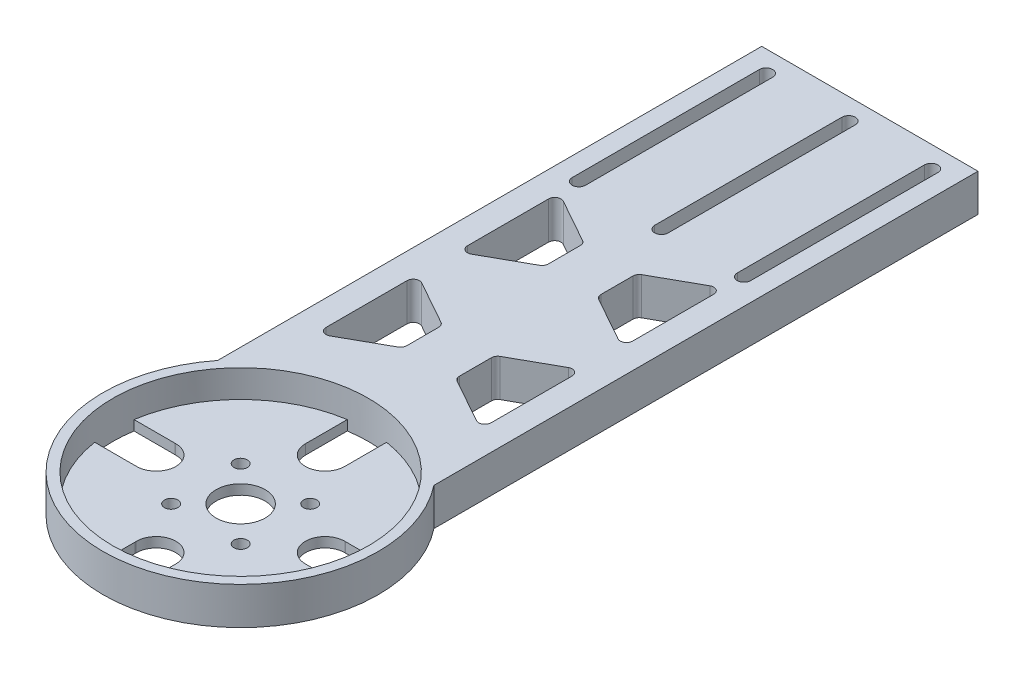
from build123d import *

# Parameters (mm, degrees)
BOSS_EXTRUDE1_OUTLINE_R = 6.25
BOSS_EXTRUDE1_DEPTH     = 9.525
CUT_EXTRUDE1_START      = -7
SKETCH3_R               = 32.5
CUT_EXTRUDE1_DEPTH      = 7
M3_CLEARANCE_HOLE1_D    = 3.4


# Read off the part's stored shape, not the designer's step: Boss-Extrude1
with BuildPart() as part:
    # Boss-Extrude1 outline → Boss-Extrude1 (new body)
    with BuildSketch(Plane(origin=(0, 0, 0), x_dir=(1, 0, 0), z_dir=(0, 1, 0))):
        with BuildLine():
            Line((-27.5, 160), (-27.5, 21.650635095))
            ThreePointArc((-27.5, 21.650635095), (0, -35), (27.5, 21.650635095))
            Line((27.5, 21.650635095), (27.5, 160))
            Line((27.5, 160), (-27.5, 160))
        make_face()
        with BuildLine():
            Line((-21.67, -5), (-32.113081447, -5))
            ThreePointArc((-32.113081447, -5), (-32.5, 0), (-32.113081447, 5))
            Line((-32.113081447, 5), (-21.67, 5))
            ThreePointArc((-21.67, 5), (-21.6199975, 4.999749969), (-21.57, 4.9989999))
            ThreePointArc((-21.57, 4.9989999), (-16.47, 0), (-21.57, -4.9989999))
            ThreePointArc((-21.57, -4.9989999), (-21.6199975, -4.999749969), (-21.67, -5))
        make_face(mode=Mode.SUBTRACT)
        with BuildLine():
            Line((-21, 42.707149814), (-21, 63.292850186))
            ThreePointArc((-21, 63.292850186), (-20.2155368, 64.662261792), (-18.637432255, 64.678283779))
            Line((-18.637432255, 64.678283779), (-7.512432255, 58.454507556))
            ThreePointArc((-7.512432255, 58.454507556), (-6.918088394, 57.872110763), (-6.7, 57.069073962))
            Line((-6.7, 57.069073962), (-6.7, 48.930926038))
            ThreePointArc((-6.7, 48.930926038), (-6.918088394, 48.127889237), (-7.512432255, 47.545492444))
            Line((-7.512432255, 47.545492444), (-18.637432255, 41.321716221))
            ThreePointArc((-18.637432255, 41.321716221), (-20.2155368, 41.337738208), (-21, 42.707149814))
        make_face(mode=Mode.SUBTRACT)
        with BuildLine():
            Line((5, -21.872218084), (5, -32.113081447))
            ThreePointArc((5, -32.113081447), (0, -32.5), (-5, -32.113081447))
            Line((-5, -32.113081447), (-5, -21.872218084))
            ThreePointArc((-5, -21.872218084), (-4.998988367, -21.771643214), (-4.995953878, -21.671109042))
            ThreePointArc((-4.995953878, -21.671109042), (0, -16.47), (4.995953878, -21.671109042))
            ThreePointArc((4.995953878, -21.671109042), (4.998988367, -21.771643214), (5, -21.872218084))
        make_face(mode=Mode.SUBTRACT)
        Circle(BOSS_EXTRUDE1_OUTLINE_R, mode=Mode.SUBTRACT)
        with BuildLine():
            Line((21.67, 5), (32.113081447, 5))
            ThreePointArc((32.113081447, 5), (32.5, 0), (32.113081447, -5))
            Line((32.113081447, -5), (21.67, -5))
            ThreePointArc((21.67, -5), (21.6199975, -4.999749969), (21.57, -4.9989999))
            ThreePointArc((21.57, -4.9989999), (16.47, 0), (21.57, 4.9989999))
            ThreePointArc((21.57, 4.9989999), (21.6199975, 4.999749969), (21.67, 5))
        make_face(mode=Mode.SUBTRACT)
        with BuildLine():
            Line((-5, 21.466517846), (-5, 32.113081447))
            ThreePointArc((-5, 32.113081447), (0, 32.5), (5, 32.113081447))
            Line((5, 32.113081447), (5, 21.466517846))
            ThreePointArc((5, 21.466517846), (0, 16.466517846), (-5, 21.466517846))
        make_face(mode=Mode.SUBTRACT)
        with BuildLine():
            ThreePointArc((7.512432255, 47.545492444), (6.918088394, 48.127889237), (6.7, 48.930926038))
            Line((6.7, 48.930926038), (6.7, 57.069073962))
            ThreePointArc((6.7, 57.069073962), (6.918088394, 57.872110763), (7.512432255, 58.454507556))
            Line((7.512432255, 58.454507556), (18.637432255, 64.678283779))
            ThreePointArc((18.637432255, 64.678283779), (20.2155368, 64.662261792), (21, 63.292850186))
            Line((21, 63.292850186), (21, 42.707149814))
            ThreePointArc((21, 42.707149814), (20.2155368, 41.337738208), (18.637432255, 41.321716221))
            Line((18.637432255, 41.321716221), (7.512432255, 47.545492444))
        make_face(mode=Mode.SUBTRACT)
        with BuildLine():
            Line((-21, 78.707149814), (-21, 99.292850186))
            ThreePointArc((-21, 99.292850186), (-20.2155368, 100.662261792), (-18.637432255, 100.678283779))
            Line((-18.637432255, 100.678283779), (-7.512432255, 94.454507556))
            ThreePointArc((-7.512432255, 94.454507556), (-6.918088394, 93.872110763), (-6.7, 93.069073962))
            Line((-6.7, 93.069073962), (-6.7, 84.930926038))
            ThreePointArc((-6.7, 84.930926038), (-6.918088394, 84.127889237), (-7.512432255, 83.545492444))
            Line((-7.512432255, 83.545492444), (-18.637432255, 77.321716221))
            ThreePointArc((-18.637432255, 77.321716221), (-20.2155368, 77.337738208), (-21, 78.707149814))
        make_face(mode=Mode.SUBTRACT)
        with BuildLine():
            Line((-19.3, 154.596553922), (-19.3, 107))
            ThreePointArc((-19.3, 107), (-21, 105.3), (-22.7, 107))
            Line((-22.7, 107), (-22.7, 154.596553922))
            ThreePointArc((-22.7, 154.596553922), (-21, 156.296553922), (-19.3, 154.596553922))
        make_face(mode=Mode.SUBTRACT)
        with BuildLine():
            ThreePointArc((18.637432255, 100.678283779), (20.2155368, 100.662261792), (21, 99.292850186))
            Line((21, 99.292850186), (21, 78.707149814))
            ThreePointArc((21, 78.707149814), (20.2155368, 77.337738208), (18.637432255, 77.321716221))
            Line((18.637432255, 77.321716221), (7.512432255, 83.545492444))
            ThreePointArc((7.512432255, 83.545492444), (6.918088394, 84.127889237), (6.7, 84.930926038))
            Line((6.7, 84.930926038), (6.7, 93.069073962))
            ThreePointArc((6.7, 93.069073962), (6.918088394, 93.872110763), (7.512432255, 94.454507556))
            Line((7.512432255, 94.454507556), (18.637432255, 100.678283779))
        make_face(mode=Mode.SUBTRACT)
        with BuildLine():
            Line((1.7, 154.596553922), (1.7, 107))
            ThreePointArc((1.7, 107), (0, 105.3), (-1.7, 107))
            Line((-1.7, 107), (-1.7, 154.596553922))
            ThreePointArc((-1.7, 154.596553922), (0, 156.296553922), (1.7, 154.596553922))
        make_face(mode=Mode.SUBTRACT)
        with BuildLine():
            Line((22.7, 154.596553922), (22.7, 107))
            ThreePointArc((22.7, 107), (21, 105.3), (19.3, 107))
            Line((19.3, 107), (19.3, 154.596553922))
            ThreePointArc((19.3, 154.596553922), (21, 156.296553922), (22.7, 154.596553922))
        make_face(mode=Mode.SUBTRACT)
    extrude(amount=BOSS_EXTRUDE1_DEPTH)

    # Sketch3 → Cut-Extrude1 (cut)
    with BuildSketch(Plane(origin=(0, 9.525, 0), x_dir=(1, 0, 0), z_dir=(0, 1, 0)).offset(CUT_EXTRUDE1_START)):
        with Locations(Location((0, 0, 0), (0, 0, 81.150116902))):
            Circle(SKETCH3_R)
    extrude(amount=CUT_EXTRUDE1_DEPTH, mode=Mode.SUBTRACT)

    # M3 Clearance Hole1 (through all)
    with Locations(Plane(origin=(0, 2.525, 0), x_dir=(1, 0, 0), z_dir=(0, 1, 0))):
        with Locations((8.838834765, 8.838834765), (-8.838834765, -8.838834765), (-8.838834765, 8.838834765), (8.838834765, -8.838834765)):
            Hole(M3_CLEARANCE_HOLE1_D / 2)


solid = part.part
